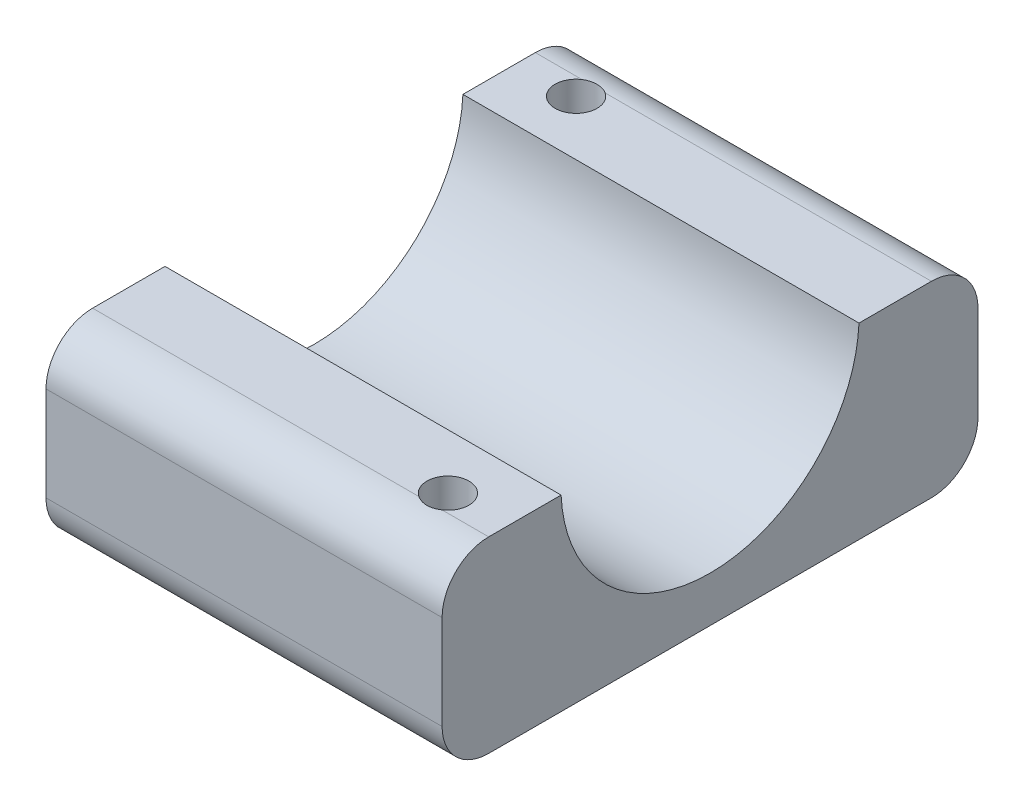
from build123d import *

# Parameters (mm, degrees)
BOSS_EXTRUDE1_DEPTH     = 17
CUT_EXTRUDE1_DEPTH      = 34.119329703
CUT_EXTRUDE1_DEPTH_BACK = 34.119329703
SKETCH2_R               = 12.8
SKETCH3_R               = 1.8
CUT_EXTRUDE2_DEPTH      = 17
SKETCH4_R               = 3.25
CUT_EXTRUDE3_DEPTH      = 7.5


with BuildPart() as part:
    # Sketch1 → Boss-Extrude1 (new, symmetric)
    with BuildSketch(Plane(origin=(0, 0, 0), x_dir=(0, 0, -1), z_dir=(1, 0, 0))):
        with BuildLine():
            Line((-19, -16.7), (19, -16.7))
            ThreePointArc((19, -16.7), (21.828427125, -15.528427125), (23, -12.7))
            Line((23, -12.7), (23, -4.6))
            ThreePointArc((23, -4.6), (21.828427125, -1.771572875), (19, -0.6))
            Line((19, -0.6), (-19, -0.6))
            ThreePointArc((-19, -0.6), (-21.828427125, -1.771572875), (-23, -4.6))
            Line((-23, -4.6), (-23, -12.7))
            ThreePointArc((-23, -12.7), (-21.828427125, -15.528427125), (-19, -16.7))
        make_face()
    extrude(amount=BOSS_EXTRUDE1_DEPTH, both=True)

    # Sketch2 → Cut-Extrude1 (cut, two sides: drawn at the far end of the back side and taken through both)
    with BuildSketch(Plane(origin=(0, 0, 0), x_dir=(0, 0, -1), z_dir=(1, 0, 0)).offset(-CUT_EXTRUDE1_DEPTH_BACK)):
        Circle(SKETCH2_R)
    extrude(amount=CUT_EXTRUDE1_DEPTH + CUT_EXTRUDE1_DEPTH_BACK, mode=Mode.SUBTRACT)

    # Sketch3 → Cut-Extrude2 (cut)
    with BuildSketch(Plane(origin=(0, -16.7, 0), x_dir=(1, 0, 0), z_dir=(0, 1, 0))):
        with Locations((12, -17.5)):
            Circle(SKETCH3_R)
        with Locations((-12, 17.5)):
            Circle(SKETCH3_R)
    extrude(amount=CUT_EXTRUDE2_DEPTH, mode=Mode.SUBTRACT)

    # Sketch4 → Cut-Extrude3 (cut)
    with BuildSketch(Plane(origin=(0, -16.7, 0), x_dir=(1, 0, 0), z_dir=(0, 1, 0))):
        with Locations((12, -17.5)):
            Circle(SKETCH4_R)
        with Locations((-12, 17.5)):
            Circle(SKETCH4_R)
    extrude(amount=CUT_EXTRUDE3_DEPTH, mode=Mode.SUBTRACT)


solid = part.part
